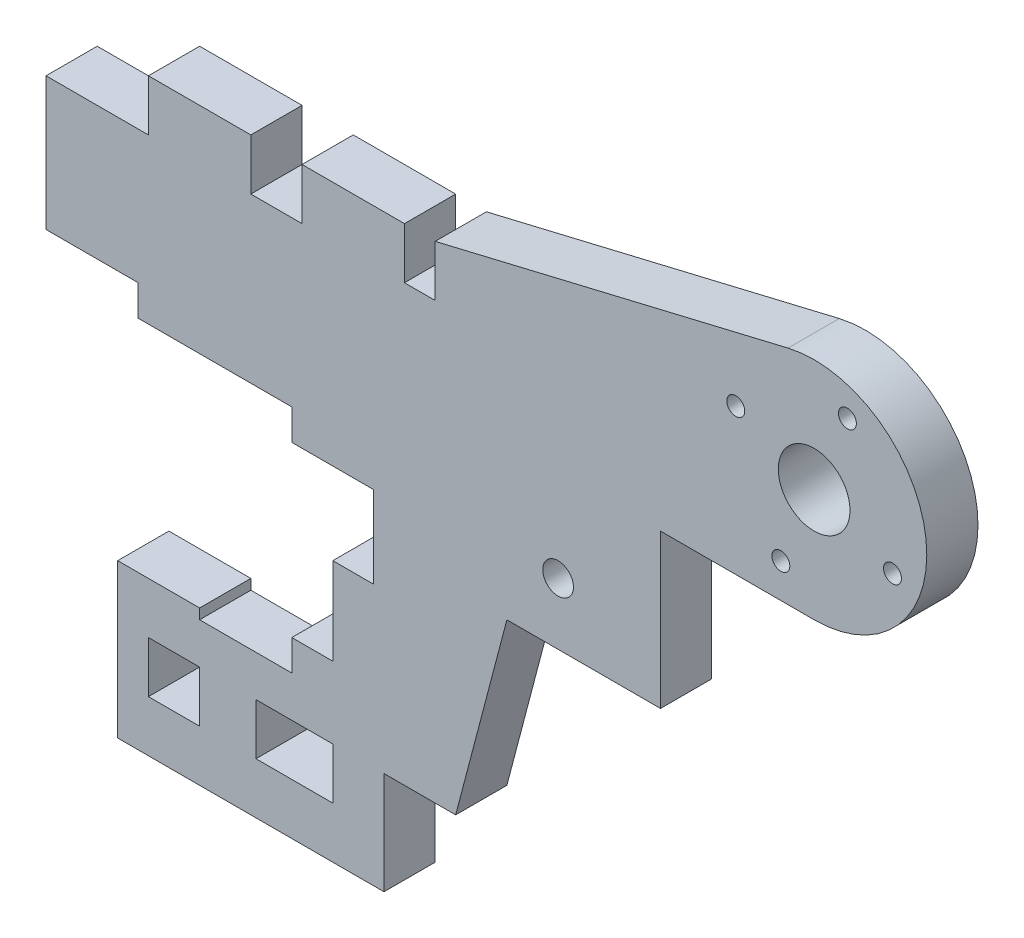
from build123d import *

# Parameters (mm, degrees)
ESQUISSE1_W        = 5
ESQUISSE1_H        = 5
ESQUISSE1_W_2      = 7.5
ESQUISSE1_R        = 1.5
ESQUISSE1_R_2      = 0.875
ESQUISSE1_R_3      = 3.5
BOSS_EXTRU_1_DEPTH = 5


with BuildPart() as part:
    # Esquisse1 → Boss.-Extru.1 (new body)
    with BuildSketch(Plane.XY):
        with BuildLine():
            Line((-8, 5), (-8, -10))
            Line((-8, -10), (18, -10))
            Line((18, -10), (18, 0))
            Line((18, 0), (25, 0))
            Line((25, 0), (30, 19))
            Line((30, 19), (45, 19))
            Line((45, 19), (45, 34))
            Line((45, 34), (60, 34))
            ThreePointArc((60, 34), (70.924996905, 46.282358225), (57.452770975, 55.701010433))
            Line((57.452770975, 55.701010433), (23, 47.5))
            Line((23, 47.5), (23, 42.5))
            Line((23, 42.5), (20, 42.5))
            Line((20, 42.5), (20, 47.5))
            Line((20, 47.5), (10, 47.5))
            Line((10, 47.5), (10, 42.5))
            Line((10, 42.5), (5, 42.5))
            Line((5, 42.5), (5, 47.5))
            Line((5, 47.5), (-5, 47.5))
            Line((-5, 47.5), (-5, 42.5))
            Line((-5, 42.5), (-15, 42.5))
            Line((-15, 42.5), (-15, 29.5))
            Line((-15, 29.5), (-6, 29.5))
            Line((-6, 29.5), (-6, 26.5))
            Line((-6, 26.5), (9, 26.5))
            Line((9, 26.5), (9, 23.5))
            Line((9, 23.5), (17, 23.5))
            Line((17, 23.5), (17, 15.5))
            Line((17, 15.5), (13, 15.5))
            Line((13, 15.5), (13, 7))
            Line((13, 7), (9, 7))
            Line((9, 7), (9, 4))
            Line((9, 4), (0, 4))
            Line((0, 4), (0, 5))
            Line((0, 5), (-8, 5))
        make_face()
        with Locations((-2.5, -2.5)):
            Rectangle(ESQUISSE1_W, ESQUISSE1_H, mode=Mode.SUBTRACT)
        with Locations((9.25, -2.5)):
            Rectangle(ESQUISSE1_W_2, ESQUISSE1_H, mode=Mode.SUBTRACT)
        with Locations((35, 25)):
            Circle(ESQUISSE1_R, mode=Mode.SUBTRACT)
        with Locations((56.75, 37.35)):
            Circle(ESQUISSE1_R_2, mode=Mode.SUBTRACT)
        with Locations((60, 45)):
            Circle(ESQUISSE1_R_3, mode=Mode.SUBTRACT)
        with Locations((67.65, 41.75)):
            Circle(ESQUISSE1_R_2, mode=Mode.SUBTRACT)
        with Locations((52.35, 48.25)):
            Circle(ESQUISSE1_R_2, mode=Mode.SUBTRACT)
        with Locations((63.25, 52.65)):
            Circle(ESQUISSE1_R_2, mode=Mode.SUBTRACT)
    extrude(amount=BOSS_EXTRU_1_DEPTH)


solid = part.part
